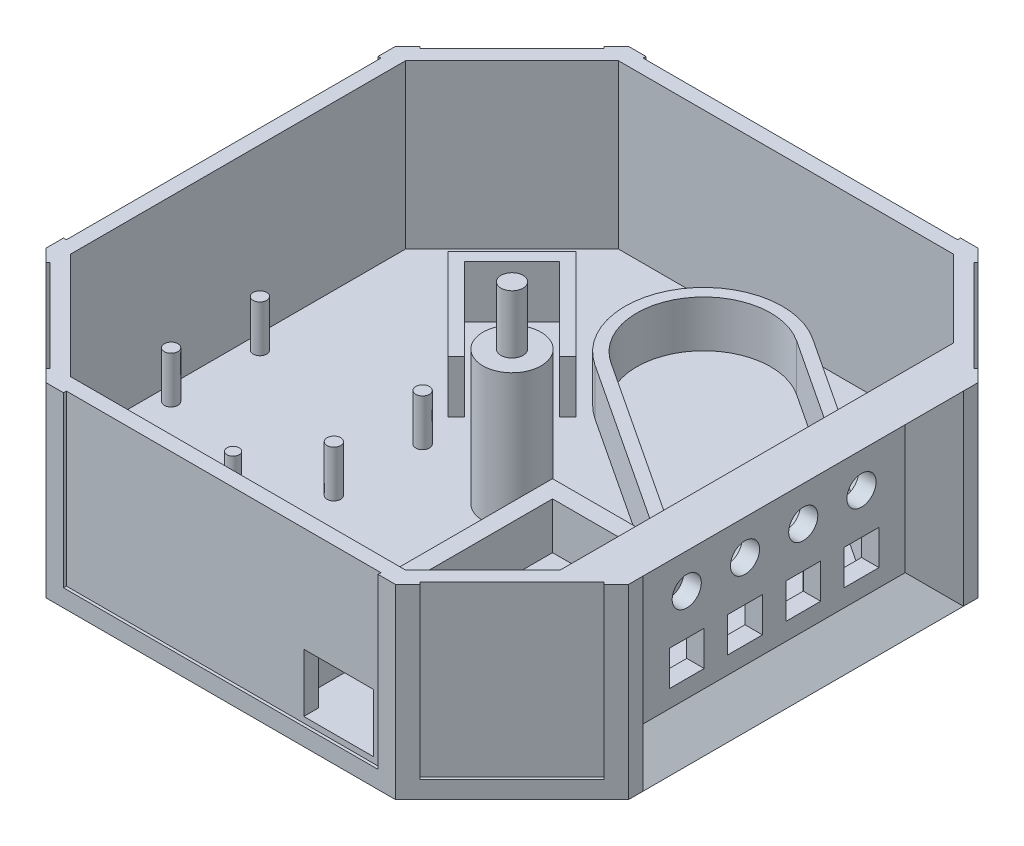
from build123d import *

# Parameters (mm, degrees)
BOSS_EXTRUDE1_DEPTH = 32
CUT_EXTRUDE1_DEPTH  = 28
SKETCH3_R           = 5
BOSS_EXTRUDE2_DEPTH = 23
SKETCH4_R           = 1.9
BOSS_EXTRUDE3_DEPTH = 10
BOSS_EXTRUDE4_DEPTH = 9
BOSS_EXTRUDE6_DEPTH = 28
SKETCH7_W           = 45
SKETCH7_H           = 22
CUT_EXTRUDE2_DEPTH  = 5
CHAMFER1_SIZE       = 5
SKETCH8_R           = 2.5
SKETCH8_W           = 6
SKETCH8_H           = 6
CUT_EXTRUDE3_DEPTH  = 5
SKETCH10_R          = 1.17
SKETCH10_R_2        = 1.043
BOSS_EXTRUDE8_DEPTH = 8
SKETCH11_W          = 12
SKETCH11_H          = 10
CUT_EXTRUDE4_DEPTH  = 8
SKETCH12_W          = 10
SKETCH12_H          = 10
CUT_EXTRUDE5_DEPTH  = 8
SKETCH16_W          = 22.284271248
SKETCH16_H          = 29
CUT_EXTRUDE6_DEPTH  = 0.5
SKETCH17_W          = 54
SKETCH17_H          = 29
CUT_EXTRUDE7_DEPTH  = 0.5
SKETCH18_W          = 22.284271248
SKETCH18_H          = 29
CUT_EXTRUDE8_DEPTH  = 0.5
SKETCH19_W          = 54
SKETCH19_H          = 29
CUT_EXTRUDE9_DEPTH  = 0.5


with BuildPart() as part:
    # Sketch1 → Boss-Extrude1 (new body)
    with BuildSketch(Plane(origin=(0, 0, 0), x_dir=(1, 0, 0), z_dir=(0, 1, 0))):
        Polygon((30, 50), (-30, 50), (-50, 30), (-50, -30), (-30, -50), (30, -50), (50, -30), (50, 30), align=None)
    extrude(amount=BOSS_EXTRUDE1_DEPTH)

    # Sketch2 → Cut-Extrude1 (cut)
    with BuildSketch(Plane(origin=(0, 32, 0), x_dir=(1, 0, 0), z_dir=(0, 1, 0))):
        Polygon((-28.757359313, -47), (28.757359313, -47), (47, -28.757359313), (47, 28.757359313), (28.757359313, 47), (-28.757359313, 47), (-47, 28.757359313), (-47, -28.757359313), align=None)
    extrude(amount=-CUT_EXTRUDE1_DEPTH, mode=Mode.SUBTRACT)

    # Sketch3 → Boss-Extrude2 (add)
    with BuildSketch(Plane(origin=(0, 4, 0), x_dir=(1, 0, 0), z_dir=(0, 1, 0))):
        with Locations(Location((0, 0, 0), (0, 0, 270))):
            Circle(SKETCH3_R)
    extrude(amount=BOSS_EXTRUDE2_DEPTH)

    # Sketch4 → Boss-Extrude3 (add)
    with BuildSketch(Plane(origin=(0, 27, 0), x_dir=(1, 0, 0), z_dir=(0, 1, 0))):
        with Locations(Location((0, 0, 0), (0, 0, 270))):
            Circle(SKETCH4_R)
    extrude(amount=BOSS_EXTRUDE3_DEPTH)

    # Sketch5 → Boss-Extrude4 (add)
    with BuildSketch(Plane(origin=(0, 4, 0), x_dir=(1, 0, 0), z_dir=(0, 1, 0))):
        Polygon((-16.970562748, 8.838834765), (-31.112698372, 22.980970389), (-22.980970389, 31.112698372), (-8.838834765, 16.970562748), (-7.424621202, 18.384776311), (-22.980970389, 33.941125497), (-33.941125497, 22.980970389), (-18.384776311, 7.424621202), align=None)
    extrude(amount=BOSS_EXTRUDE4_DEPTH)

    # Sketch6 → Boss-Extrude6 (add)
    with BuildSketch(Plane(origin=(0, 4, 0), x_dir=(1, 0, 0), z_dir=(0, 1, 0))):
        Polygon((42, -33.757359313), (47, -28.757359313), (47, 28.757359313), (42, 33.757359313), align=None)
    extrude(amount=BOSS_EXTRUDE6_DEPTH)

    # Sketch7 → Cut-Extrude2 (cut)
    with BuildSketch(Plane(origin=(50, 0, 0), x_dir=(0, 0, -1), z_dir=(1, 0, 0))):
        with Locations((0, 16)):
            Rectangle(SKETCH7_W, SKETCH7_H)
    extrude(amount=-CUT_EXTRUDE2_DEPTH, mode=Mode.SUBTRACT)

    # Chamfer1
    chamfer1_edges = [part.edges().sort_by_distance(p)[0] for p in [
        (50, 16, 22.5),
        (50, 27, 0),
        (50, 16, -22.5),
        (50, 5, 0),
    ]]
    chamfer(chamfer1_edges, length=CHAMFER1_SIZE - 0.0001)  # a hair under: the kernel refuses the full size

    # Sketch8 → Cut-Extrude3 (cut)
    with BuildSketch(Plane(origin=(45, 0, 0), x_dir=(0, 0, -1), z_dir=(1, 0, 0))):
        with Locations((-15, 21)):
            Circle(SKETCH8_R)
        with Locations((-5, 21)):
            Circle(SKETCH8_R)
        with Locations((5, 21)):
            Circle(SKETCH8_R)
        with Locations((15, 21)):
            Circle(SKETCH8_R)
        with Locations((-15, 11)):
            Rectangle(SKETCH8_W, SKETCH8_H)
        with Locations((-5, 11)):
            Rectangle(SKETCH8_W, SKETCH8_H)
        with Locations((5, 11)):
            Rectangle(SKETCH8_W, SKETCH8_H)
        with Locations((15, 11)):
            Rectangle(SKETCH8_W, SKETCH8_H)
    extrude(amount=-CUT_EXTRUDE3_DEPTH, mode=Mode.SUBTRACT)

    # Sketch10 → Boss-Extrude8 (add)
    with BuildSketch(Plane(origin=(0, 4, 0), x_dir=(1, 0, 0), z_dir=(0, 1, 0))):
        with Locations(Location((-44.46, -14.06, 0), (0, 0, 270))):
            Circle(SKETCH10_R)
        with Locations(Location((-44.46, 1.18, 0), (0, 0, 270))):
            Circle(SKETCH10_R)
        with Locations(Location((-16.52, 1.18, 0), (0, 0, 270))):
            Circle(SKETCH10_R)
        with Locations(Location((-16.52, -14.06, 0), (0, 0, 270))):
            Circle(SKETCH10_R)
        with Locations(Location((-23.738640687, -44.46, 0), (0, 0, 270))):
            Circle(SKETCH10_R_2)
        with Locations(Location((-23.738640687, -24.14, 0), (0, 0, 270))):
            Circle(SKETCH10_R_2)
        Polygon((28.757359313, -3.8), (28.757359313, -47), (31.757359313, -44), (31.757359313, -0.8), (29.355483266, -0.8), (25.717542729, -0.8), (7.757359313, -0.8), (7.757359313, -21.6), (7.757359313, -47), (10.757359313, -47), (10.757359313, -3.8), align=None)
        with BuildLine():
            Line((25.717542729, -0.8), (29.355483266, -0.8))
            Line((29.355483266, -0.8), (-4.475041798, 21.465344683))
            ThreePointArc((-4.475041798, 21.465344683), (-7.758981907, 37.393801525), (8.169474935, 40.677741633))
            Line((8.169474935, 40.677741633), (42, 18.41239695))
            Line((42, 18.41239695), (42, 20.806684353))
            Line((42, 20.806684353), (9.26899813, 42.348384846))
            ThreePointArc((9.26899813, 42.348384846), (5.919661645, 43.942642222), (2.262859211, 44.565143167))
            ThreePointArc((2.262859211, 44.565143167), (-0.878722589, 44.293466456), (-3.871580373, 43.300417249))
            ThreePointArc((-3.871580373, 43.300417249), (-6.983976281, 41.282323386), (-9.429625069, 38.493324796))
            ThreePointArc((-9.429625069, 38.493324796), (-11.023882481, 35.143988278), (-11.64638344, 31.4871858))
            ThreePointArc((-11.64638344, 31.4871858), (-11.37470673, 28.345604), (-10.381657523, 25.352746216))
            ThreePointArc((-10.381657523, 25.352746216), (-8.363563629, 22.240350274), (-5.574564992, 19.79470147))
            Line((-5.574564992, 19.79470147), (25.717542729, -0.8))
        make_face()
    extrude(amount=BOSS_EXTRUDE8_DEPTH)

    # Sketch11 → Cut-Extrude4 (cut)
    with BuildSketch(Plane(origin=(0, 0, 47), x_dir=(-1, 0, 0), z_dir=(0, 0, -1))):
        with Locations((-19.757359313, 9)):
            Rectangle(SKETCH11_W, SKETCH11_H)
    extrude(amount=-CUT_EXTRUDE4_DEPTH, mode=Mode.SUBTRACT)

    # Sketch12 → Cut-Extrude5 (cut)
    with BuildSketch(Plane(origin=(0, 4, 0), x_dir=(1, 0, 0), z_dir=(0, 1, 0))):
        with Locations((19.757359313, -20)):
            Rectangle(SKETCH12_W, SKETCH12_H)
    extrude(amount=-CUT_EXTRUDE5_DEPTH, mode=Mode.SUBTRACT)

    # Sketch16 → Cut-Extrude6 (cut)
    with BuildSketch(Plane(origin=(-40, 0, -40), x_dir=(-0.7071067811865475, 0, 0.7071067811865477), z_dir=(-0.7071067811865477, 0, -0.7071067811865475))):
        with Locations((0, 17.5)):
            Rectangle(SKETCH16_W, SKETCH16_H)
    cut_extrude6 = extrude(amount=-CUT_EXTRUDE6_DEPTH, mode=Mode.SUBTRACT)

    # Sketch17 → Cut-Extrude7 (cut)
    with BuildSketch(Plane(origin=(0, 0, -50), x_dir=(-1, 0, 0), z_dir=(0, 0, -1))):
        with Locations((0, 17.5)):
            Rectangle(SKETCH17_W, SKETCH17_H)
    cut_extrude7 = extrude(amount=-CUT_EXTRUDE7_DEPTH, mode=Mode.SUBTRACT)

    # Sketch18 → Cut-Extrude8 (cut)
    with BuildSketch(Plane(origin=(40, 0, -40), x_dir=(-0.7071067811865475, 0, -0.7071067811865477), z_dir=(0.7071067811865477, 0, -0.7071067811865475))):
        with Locations((0, 17.5)):
            Rectangle(SKETCH18_W, SKETCH18_H)
    cut_extrude8 = extrude(amount=-CUT_EXTRUDE8_DEPTH, mode=Mode.SUBTRACT)

    # Mirror1: Cut-Extrude6, Cut-Extrude7, Cut-Extrude8 across plane
    add(cut_extrude6.mirror(Plane.XY), mode=Mode.SUBTRACT)
    add(cut_extrude7.mirror(Plane.XY), mode=Mode.SUBTRACT)
    add(cut_extrude8.mirror(Plane.XY), mode=Mode.SUBTRACT)

    # Sketch19 → Cut-Extrude9 (cut)
    with BuildSketch(Plane.ZY.offset(50)):
        with Locations((0, 17.5)):
            Rectangle(SKETCH19_W, SKETCH19_H)
    extrude(amount=-CUT_EXTRUDE9_DEPTH, mode=Mode.SUBTRACT)


solid = part.part
